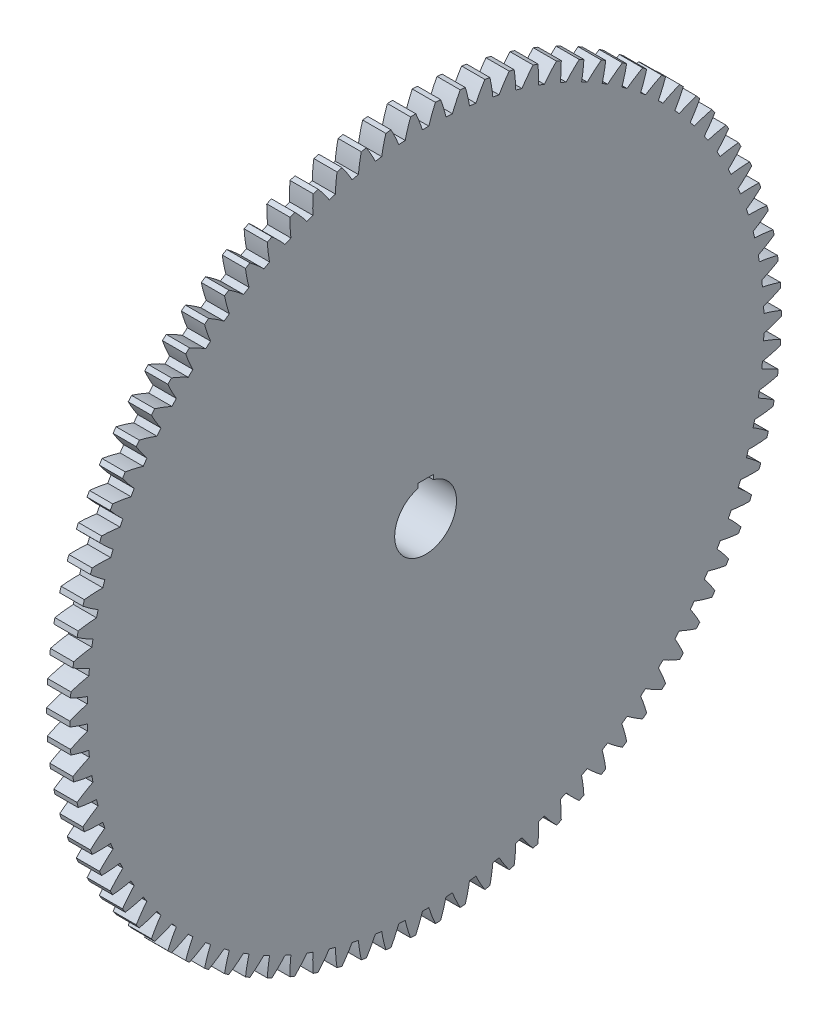
from build123d import *

# Parameters (mm, degrees)
BASPROSKE_W      = 75
BASPROSKE_H      = 1150
TOOTHCUT_DEPTH   = 1629.074015516
TEETHCUTS_COUNT  = 90
TEETHCUTS_ANGLE  = 356
HUBNEAONESKE_R   = 375
HUBNEARONE_DEPTH = 75.0000508
BORSKE_R         = 100
BORE_DEPTH       = 150.0000508
KEYSKE_W         = 50
KEYSKE_H         = 111.4
KEYWAY_DEPTH     = 150.0000508


with BuildPart() as part:
    # BasProSke → Base-Revolve (revolve)
    with BuildSketch(Plane(origin=(0, 0, 0), x_dir=(1, 0, 0), z_dir=(0, 1, 0))):
        with Locations((37.5, 575)):
            Rectangle(BASPROSKE_W, BASPROSKE_H)
    revolve(axis=Axis((-10, 0, 0), (1, 0, 0)))

    # TooCutSke → ToothCut (cut, through all)
    with BuildSketch(Plane(origin=(0, 0, 0), x_dir=(0, 0, -1), z_dir=(1, 0, 0))):
        with BuildLine():
            ThreePointArc((10.422939454, 1093.699335894), (0, 1093.749), (-10.422939454, 1093.699335894))
            ThreePointArc((-10.422939454, 1093.699335894), (-20.195571217, 1121.998330871), (-31.828289381, 1149.584873178))
            ThreePointArc((-31.828289381, 1149.584873178), (0, 1150.0254), (31.828289381, 1149.584873178))
            ThreePointArc((31.828289381, 1149.584873178), (20.195571217, 1121.998330871), (10.422939454, 1093.699335894))
        make_face()
    toothcut = extrude(amount=TOOTHCUT_DEPTH, mode=Mode.SUBTRACT)

    # TeethCuts: ToothCut ×90 about axis
    teethcuts_axis = Axis((-10, 0, 0), (1, 0, 0))
    for i in range(1, TEETHCUTS_COUNT):
        add(toothcut.rotate(teethcuts_axis, i * TEETHCUTS_ANGLE / (TEETHCUTS_COUNT - 1)), mode=Mode.SUBTRACT)

    # HubNeaOneSke → HubNearOne (add)
    with BuildSketch(Plane.ZY):
        Circle(HUBNEAONESKE_R)
    extrude(amount=HUBNEARONE_DEPTH)

    # BorSke → Bore (cut, symmetric)
    with BuildSketch(Plane(origin=(0, 0, 0), x_dir=(0, 0, -1), z_dir=(1, 0, 0))):
        Circle(BORSKE_R)
    extrude(amount=BORE_DEPTH, both=True, mode=Mode.SUBTRACT)

    # KeySke → Keyway (cut, symmetric)
    with BuildSketch(Plane(origin=(0, 0, 0), x_dir=(0, 0, -1), z_dir=(1, 0, 0))):
        with Locations((0, 55.7)):
            Rectangle(KEYSKE_W, KEYSKE_H)
    extrude(amount=KEYWAY_DEPTH, both=True, mode=Mode.SUBTRACT)


solid = part.part
